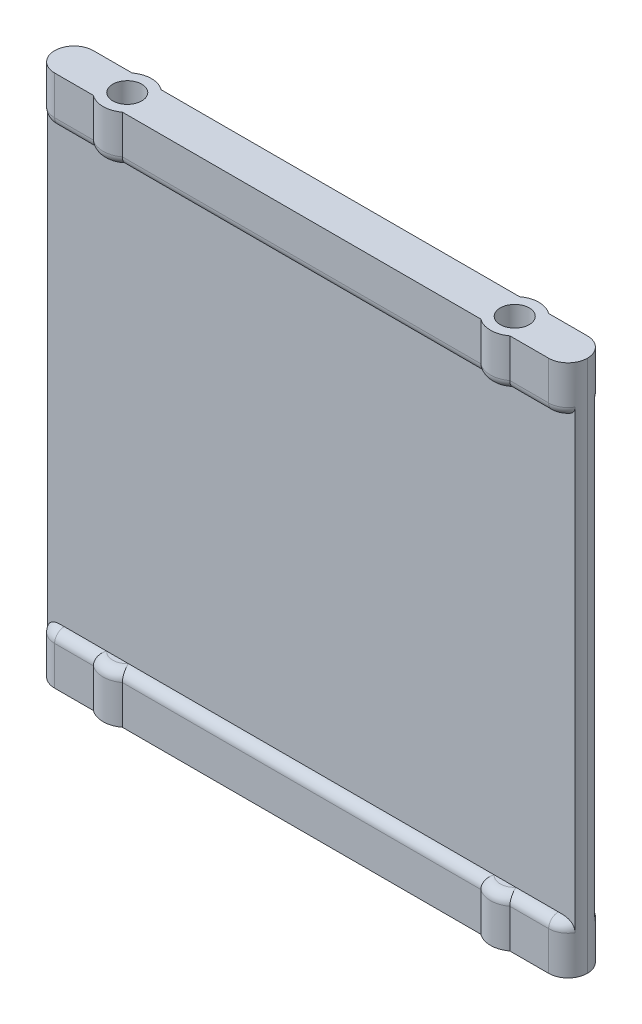
from build123d import *

# Parameters (mm, degrees)
BOSS_EXTRUDE1_DEPTH     = 55
SKETCH2_R               = 1.5000000000000007
CUT_EXTRUDE1_DEPTH      = 2.8
CUT_EXTRUDE2_START      = -2.8
SKETCH3_R               = 1.5000000000000007
CUT_EXTRUDE2_DEPTH      = 2.8
CUT_EXTRUDE3_DEPTH      = 5
CUT_EXTRUDE3_DEPTH_BACK = 1
CUT_EXTRUDE4_DEPTH      = 1
CUT_EXTRUDE4_DEPTH_BACK = 1
FILLET1_R               = 2
FILLET2_R               = 1


with BuildPart() as part:
    # Sketch1 → Boss-Extrude1 (new body)
    with BuildSketch(Plane(origin=(0, 0, 0), x_dir=(1, 0, 0), z_dir=(0, 1, 0))):
        with BuildLine():
            Line((-18.500000000000032, 1.9999999999999996), (-21.500000000000068, 1.9999999999999996))
            ThreePointArc((-21.500000000000053, 1.9999999999999463), (-22.499999999999986, -1.91e-15), (-21.50000000000005, -1.9999999999999476))
            Line((-21.500000000000064, -2.0000000000000004), (-18.500000000000036, -2.0000000000000004))
            ThreePointArc((-18.50000000000003, -2.0000000000000226), (-17.763932022500214, -1.1180339887499129), (-17.499999999999993, -6.1e-16))
            ThreePointArc((-17.499999999999993, 0), (-17.763932022500214, 1.1180339887499113), (-18.500000000000025, 2.0000000000000213))
        make_face()
        with BuildLine():
            ThreePointArc((-18.500000000000025, 2.000000000000021), (-20.00000000000005, 2.4999999999999947), (-21.500000000000053, 1.9999999999999463))
            Line((-21.500000000000068, 1.9999999999999996), (-18.500000000000032, 1.9999999999999996))
        make_face()
        with BuildLine():
            Line((-18.500000000000036, -2.0000000000000004), (-21.500000000000064, -2.0000000000000004))
            ThreePointArc((-21.50000000000005, -1.9999999999999476), (-20.000000000000053, -2.4999999999999947), (-18.50000000000003, -2.0000000000000226))
        make_face()
        with BuildLine():
            Line((-21.500000000000068, 1.9999999999999996), (-27.49999999999999, 1.9999999999999996))
            Line((-27.49999999999999, 1.9999999999999996), (-27.49999999999999, -2.0000000000000004))
            Line((-27.49999999999999, -2.0000000000000004), (-21.500000000000064, -2.0000000000000004))
            ThreePointArc((-21.50000000000005, -1.9999999999999476), (-22.499999999999986, -1.91e-15), (-21.500000000000053, 1.9999999999999463))
        make_face()
        with BuildLine():
            Line((18.49999999999991, 1.9999999999999996), (-18.500000000000032, 1.9999999999999996))
            ThreePointArc((-18.500000000000025, 2.0000000000000213), (-17.763932022500214, 1.1180339887499113), (-17.499999999999993, 0))
            ThreePointArc((-17.499999999999993, -6.1e-16), (-17.763932022500214, -1.1180339887499129), (-18.50000000000003, -2.0000000000000226))
            Line((-18.500000000000036, -2.0000000000000004), (18.499999999999925, -2.0000000000000004))
            ThreePointArc((18.499999999999932, -1.9999999999999478), (17.5, -1.91e-15), (18.49999999999993, 1.9999999999999456))
        make_face()
        with BuildLine():
            ThreePointArc((21.49999999999997, 2.00000000000002), (19.99999999999994, 2.4999999999999982), (18.49999999999993, 1.9999999999999456))
            Line((18.49999999999991, 1.9999999999999996), (21.499999999999968, 1.9999999999999996))
        make_face()
        with BuildLine():
            Line((21.499999999999968, 1.9999999999999996), (18.49999999999991, 1.9999999999999996))
            ThreePointArc((18.49999999999993, 1.9999999999999456), (17.5, -1.91e-15), (18.499999999999932, -1.9999999999999478))
            Line((18.49999999999992, -2.0000000000000004), (21.499999999999954, -2.0000000000000004))
            ThreePointArc((21.499999999999964, -2.0000000000000244), (22.23606797749978, -1.1180339887499124), (22.5, -6.1e-16))
            ThreePointArc((22.5, 0), (22.23606797749978, 1.11803398874991), (21.49999999999997, 2.00000000000002))
        make_face()
        with BuildLine():
            Line((21.499999999999954, -2.0000000000000004), (18.49999999999992, -2.0000000000000004))
            ThreePointArc((18.499999999999932, -1.9999999999999478), (19.999999999999936, -2.4999999999999982), (21.499999999999964, -2.0000000000000244))
        make_face()
        with BuildLine():
            Line((27.50000000000001, 1.9999999999999996), (21.499999999999968, 1.9999999999999996))
            ThreePointArc((21.49999999999997, 2.00000000000002), (22.23606797749978, 1.11803398874991), (22.5, 0))
            ThreePointArc((22.5, -6.1e-16), (22.23606797749978, -1.1180339887499124), (21.499999999999964, -2.0000000000000244))
            Line((21.499999999999954, -2.0000000000000004), (27.50000000000001, -2.0000000000000004))
            Line((27.50000000000001, -2.0000000000000004), (27.50000000000001, 1.9999999999999996))
        make_face()
    extrude(amount=BOSS_EXTRUDE1_DEPTH)

    # Sketch2 → Cut-Extrude1 (cut)
    with BuildSketch(Plane(origin=(0, 55, 0), x_dir=(1, 0, 0), z_dir=(0, 1, 0))):
        with Locations(Location((-19.99999999999999, 0, 0), (0, 0, 270))):
            Circle(SKETCH2_R)
        with Locations(Location((20, 0, 0), (0, 0, 270))):
            Circle(SKETCH2_R)
    extrude(amount=-CUT_EXTRUDE1_DEPTH, mode=Mode.SUBTRACT)

    # Sketch3 → Cut-Extrude2 (cut)
    with BuildSketch(Plane.XZ.offset(CUT_EXTRUDE2_START)):
        with Locations(Location((-19.99999999999999, 0, 0), (0, 0, 90))):
            Circle(SKETCH3_R)
        with Locations(Location((20, 0, 0), (0, 0, 90))):
            Circle(SKETCH3_R)
    extrude(amount=CUT_EXTRUDE2_DEPTH, mode=Mode.SUBTRACT)

    # Sketch4 → Cut-Extrude3 (cut, two sides: drawn at the far end of the back side and taken through both)
    with BuildSketch(Plane.XY.offset(2.0000000000000004).offset(-CUT_EXTRUDE3_DEPTH_BACK)):
        Polygon((-27.500000000000018, 50), (27.500000000000007, 50), (27.50000000000001, 5.000000000000008), (-27.50000000000001, 5.000000000000008), align=None)
    extrude(amount=CUT_EXTRUDE3_DEPTH + CUT_EXTRUDE3_DEPTH_BACK, mode=Mode.SUBTRACT)

    # Sketch5 → Cut-Extrude4 (cut, two sides: drawn at the far end of the back side and taken through both)
    with BuildSketch(Plane(origin=(0, 0, -1.9999999999999996), x_dir=(-1, 0, 0), z_dir=(0, 0, -1)).offset(-CUT_EXTRUDE4_DEPTH_BACK)):
        Polygon((-27.49999999999999, 50), (27.49999999999999, 50), (27.499999999999986, 5.000000000000001), (-27.49999999999998, 5.000000000000001), align=None)
    extrude(amount=CUT_EXTRUDE4_DEPTH + CUT_EXTRUDE4_DEPTH_BACK, mode=Mode.SUBTRACT)

    # Fillet1
    fillet1_edges = [part.edges().sort_by_distance(p)[0] for p in [
        (-27.49999999999999, 52.5, 2.0000000000000004),
    ]]
    fillet(fillet1_edges, radius=FILLET1_R)
    fillet1_2_edges = [part.edges().sort_by_distance(p)[0] for p in [
        (-27.49999999999999, 2.5000000000000004, -1.9999999999999996),
    ]]
    fillet(fillet1_2_edges, radius=FILLET1_R - 0.0004)  # a hair under: the kernel refuses the full size
    fillet1_3_edges = [part.edges().sort_by_distance(p)[0] for p in [
        (27.50000000000001, 52.5, 2.0000000000000004),
    ]]
    fillet(fillet1_3_edges, radius=FILLET1_R)
    fillet1_4_edges = [part.edges().sort_by_distance(p)[0] for p in [
        (27.50000000000001, 2.5000000000000004, -1.9999999999999996),
    ]]
    fillet(fillet1_4_edges, radius=FILLET1_R - 0.0004)  # a hair under: the kernel refuses the full size

    # Fillet2
    fillet2_edges = [part.edges().sort_by_distance(p)[0] for p in [
        (-19.999999999999986, 50, -2.499999999999992),
        (19.999999999999996, 50, -2.500000000000009),
        (19.999999999999996, 5.000000000000001, -2.500000000000009),
        (-19.999999999999986, 5.000000000000001, -2.499999999999992),
        (-5.684e-14, 50, -1.9999999999999996),
        (23.500199999999992, 5.000000000000001, -1.9999999999999996),
        (-5.151e-14, 5.000000000000001, -1.9999999999999996),
        (23.500200169244646, 50, -1.9999999999999996),
        (-26.5002999949995, 50, -1.7320466614179624),
        (26.50030014156478, 50, -1.7320465767871778),
        (-23.500200000000024, 5.000000000000001, -1.9999999999999996),
        (-26.50029999499948, 5.000000000000001, -1.7320466614179733),
        (26.500299994999555, 5.000000000000001, -1.732046661417944),
        (-23.500000000000025, 5.000000000000008, 2.0000000000000004),
        (-26.49999999999999, 5.000000000000007, 1.7320508075688776),
        (26.500000103238282, 5.000000000000007, 1.7320507479642298),
        (23.499999999999982, 50, 2.0000000000000004),
        (-26.499999999999982, 50, 1.7320508075688823),
        (26.50000000000001, 50, 1.732050807568878),
        (-20.000000000000053, 50, 2.4999999999999925),
        (-23.50000000000002, 50, 2.0000000000000004),
        (19.999999999999932, 50, 2.499999999999999),
        (-5.329e-14, 50, 2.0000000000000004),
        (-20.000000000000053, 5.000000000000008, 2.4999999999999925),
        (-5.507e-14, 5.000000000000008, 2.0000000000000004),
        (19.999999999999932, 5.000000000000008, 2.499999999999999),
        (23.500000119209272, 5.000000000000008, 2.0000000000000004),
        (-23.500200000000024, 50, -1.9999999999999996),
    ]]
    fillet(fillet2_edges, radius=FILLET2_R - 0.0001)  # a hair under: the kernel refuses the full size


solid = part.part
